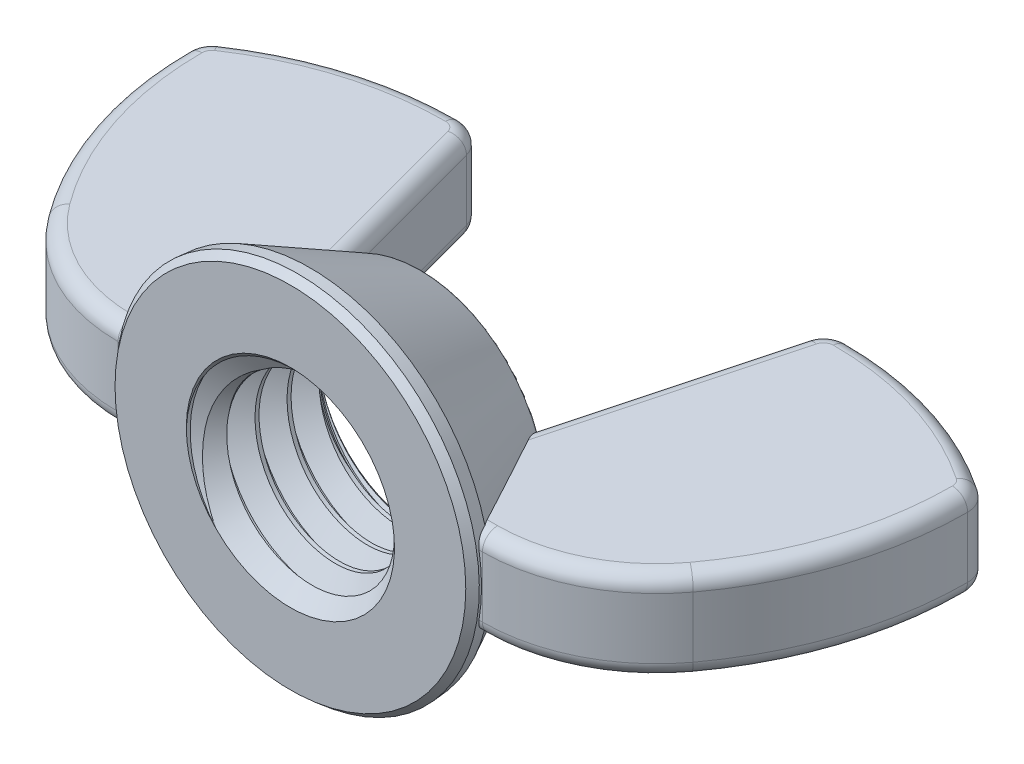
from build123d import *

# Parameters (mm, degrees)
EXTRUDE2_DEPTH     = 2.778125
SKETCH3_R          = 11.1125
EXTRUDE1_DEPTH     = 1.20015
EXTRUDE1_DRAFT     = -5
SKETCH15_R         = 11.00750048
EXTRUDE3_DEPTH     = 6.80085
EXTRUDE3_TAPER     = 27.347507114
FILLET3_R          = 0.254
SKETCH4_R          = 6.35
CUT_EXTRUDE1_DEPTH = 35.41617988
SWEEP1_PITCH       = 1.953846154
SKETCH7_R          = 11.1125
CUT_EXTRUDE2_DEPTH = 35.416179912
SKETCH8_R          = 11.00750048
CUT_EXTRUDE3_DEPTH = 30.880511889
SKETCH11_R         = 6.2992
CUT_EXTRUDE5_DEPTH = 30.880511851
CUT_EXTRUDE5_TAPER = 45
CHAMFER1_SIZE      = 0.45005625
CHAMFER1_SIZE2     = 0.415429978
FILLET4_R          = 0.926041667


with BuildPart() as part:
    # Sketch13 → Extrude2 (new, symmetric)
    with BuildSketch(Plane(origin=(0, 0, 0), x_dir=(1, 0, 0), z_dir=(0, 1, 0))):
        with BuildLine():
            Line((6.835657798, 0.600075), (11.1125, 0.600075))
            ThreePointArc((11.1125, 0.600075), (15.898904728, 1.73780557), (19.661405298, 4.907614796))
            ThreePointArc((19.661405298, 4.907614796), (22.747929146, 10.865499674), (23.8125, 17.49043066))
            ThreePointArc((23.8125, 17.49043066), (23.63184099, 18.215014374), (23.132157103, 18.769969552))
            ThreePointArc((23.132157103, 18.769969552), (17.73988829, 21.341949842), (11.831261716, 22.225))
            ThreePointArc((11.831261716, 22.225), (10.891697636, 21.906060971), (10.340449113, 21.081059255))
            Line((10.340449113, 21.081059255), (6.835657798, 8.001))
            Line((6.835657798, 8.001), (6.835657798, 0.600075))
        make_face()
    extrude(amount=EXTRUDE2_DEPTH, both=True)

    # Fillet4
    fillet4_edges = [part.edges().sort_by_distance(p)[0] for p in [
        (15.898904728, 2.778125, -1.73780557),
        (8.974078899, -2.778125, -0.600075),
        (22.747929146, 2.778125, -10.865499674),
        (23.63184099, 2.778125, -18.215014374),
        (17.73988829, 2.778125, -21.341949842),
        (10.891697636, 2.778125, -21.906060971),
        (8.588053456, 2.778125, -14.541029628),
        (8.974078899, 2.778125, -0.600075),
        (8.588053456, -2.778125, -14.541029628),
        (10.891697636, -2.778125, -21.906060971),
        (17.73988829, -2.778125, -21.341949842),
        (23.63184099, -2.778125, -18.215014374),
        (22.747929146, -2.778125, -10.865499674),
        (15.898904728, -2.778125, -1.73780557),
    ]]
    fillet(fillet4_edges, radius=FILLET4_R)


with BuildPart() as body_2:
    # Sketch3 → Extrude1 (with draft: the straight prism first)
    with BuildSketch(Plane.XY):
        Circle(SKETCH3_R)
    extrude(amount=-EXTRUDE1_DEPTH)
    # Extrude1: the draft: its side faces are tilted about the plane it starts from
    extrude1_sides = [body_2.faces().sort_by_distance(p)[0] for p in [
        (-11.1125, 0, -0.600075),
    ]]
    draft(extrude1_sides, Plane.XY, EXTRUDE1_DRAFT)

    # Sketch15 → Extrude3 (add)
    with BuildSketch(Plane(origin=(0, 0, -1.20015), x_dir=(-1, 0, 0), z_dir=(0, 0, -1))):
        Circle(SKETCH15_R)
    extrude(amount=EXTRUDE3_DEPTH, taper=EXTRUDE3_TAPER)

    # Fillet3
    fillet3_edges = [body_2.edges().sort_by_distance(p)[0] for p in [
        (7.490175812, 0, -8.001),
    ]]
    fillet(fillet3_edges, radius=FILLET3_R)

    # Sketch4 → Cut-Extrude1 (cut, through all)
    with BuildSketch(Plane.XY):
        Circle(SKETCH4_R)
    extrude(amount=-CUT_EXTRUDE1_DEPTH, mode=Mode.SUBTRACT)

    # Sweep1: arcs per turn and ends read off the stored shape
    # Sweep1: the profile of Sketch6 profile screwed along a right-hand helix through 6 turns, 6 arcs to a turn; built about Z, then put on its axis
    sweep1_z = Axis((0, 0, 0), (0, 0, 1))
    sweep1_corners = [(6.3503, 0, -1.70978859), (5.080939697, 0, -0.976923077), (5.080939697, 0, -0.732692308), (6.3503, 0, 0.000173205)]
    with BuildLine(mode=Mode.PRIVATE) as sweep1_profile:
        Line(sweep1_corners[0], sweep1_corners[1])
        Line(sweep1_corners[1], sweep1_corners[2])
        Line(sweep1_corners[2], sweep1_corners[3])
        Line(sweep1_corners[3], sweep1_corners[0])
    sweep1_cap = Face(sweep1_profile.wire())
    sweep1_turn_angles = [0, 30, 60, 90, 120, 150, 180, 210, 240, 270, 300, 330, 360]
    sweep1_turn_weights = [1, 0.8660254037844387, 1, 0.8660254037844387, 1, 0.8660254037844387, 1, 0.8660254037844387, 1, 0.8660254037844387, 1, 0.8660254037844387, 1]
    sweep1_turn_rails = [Edge.make_bspline([Vector(p[0], p[1], 0).rotate(sweep1_z, sweep1_turn_angles[k]) / sweep1_turn_weights[k] + Vector(0, 0, p[2] + SWEEP1_PITCH * sweep1_turn_angles[k] / 360) for k in range(13)], [0, 0, 0, 1, 1, 2, 2, 3, 3, 4, 4, 5, 5, 6, 6, 6], 2, sweep1_turn_weights) for p in sweep1_corners]
    sweep1_turn_sides = [Face.make_surface_from_curves(sweep1_turn_rails[p[0]], sweep1_turn_rails[p[1]]) for p in [(0, 1), (1, 2), (2, 3), (3, 0)]]
    sweep1 = Plane(origin=(0, 0, 0), x_dir=(-1, 0, 0), z_dir=(0, 0, -1)) * Solid(Shell([*[p.moved(Location((0, 0, SWEEP1_PITCH * i))) for i in range(6) for p in sweep1_turn_sides], sweep1_cap, sweep1_cap.rotate(sweep1_z, 2160).moved(Location((0, 0, SWEEP1_PITCH * 2160 / 360)))]))
    add(sweep1)

    # Sketch7 → Cut-Extrude2 (cut, through all)
    with BuildSketch(Plane.XY):
        Circle(SKETCH7_R)
    extrude(amount=CUT_EXTRUDE2_DEPTH, mode=Mode.SUBTRACT)

    # Sketch8 → Cut-Extrude3 (cut, through all)
    with BuildSketch(Plane.XY.offset(-8.001)):
        Circle(SKETCH8_R)
    extrude(amount=-CUT_EXTRUDE3_DEPTH, mode=Mode.SUBTRACT)

    # Cut-Extrude4 cone 1 section (through the dimple's axis) → Cut-Extrude4 (revolve, cut)
    with BuildSketch(Plane(origin=(0, 0, 0), x_dir=(0, -1, 0), z_dir=(1, 0, 0))):
        Polygon((0, 0), (6.35, 0), (0, 6.35), align=None)
    revolve(axis=Axis((0, 0, 0), (0, 0, -1)), mode=Mode.SUBTRACT)

    # Sketch11 → Cut-Extrude5 (cut, through all)
    with BuildSketch(Plane.XY.offset(-8.001)):
        Circle(SKETCH11_R)
    extrude(amount=CUT_EXTRUDE5_DEPTH, taper=CUT_EXTRUDE5_TAPER, mode=Mode.SUBTRACT)

    # Chamfer1
    chamfer1_edges = [body_2.edges().sort_by_distance(p)[0] for p in [
        (-11.1125, 0, 0),
    ]]
    chamfer1_side = [body_2.faces().sort_by_distance(p)[0] for p in [
        (-11.06000024, 0, -0.600075),
    ]]
    chamfer(chamfer1_edges, length=CHAMFER1_SIZE, length2=CHAMFER1_SIZE2, reference=chamfer1_side[0])


with BuildPart() as body_3:
    # Mirror6: mirrored copy
    add(part.part.mirror(Plane(origin=(0, 0, 0), x_dir=(0, 0, 1), z_dir=(1, 0, 0))))

    # Combine2: union part, body 2
    add(part.part)
    add(body_2.part)


solid = body_3.part
